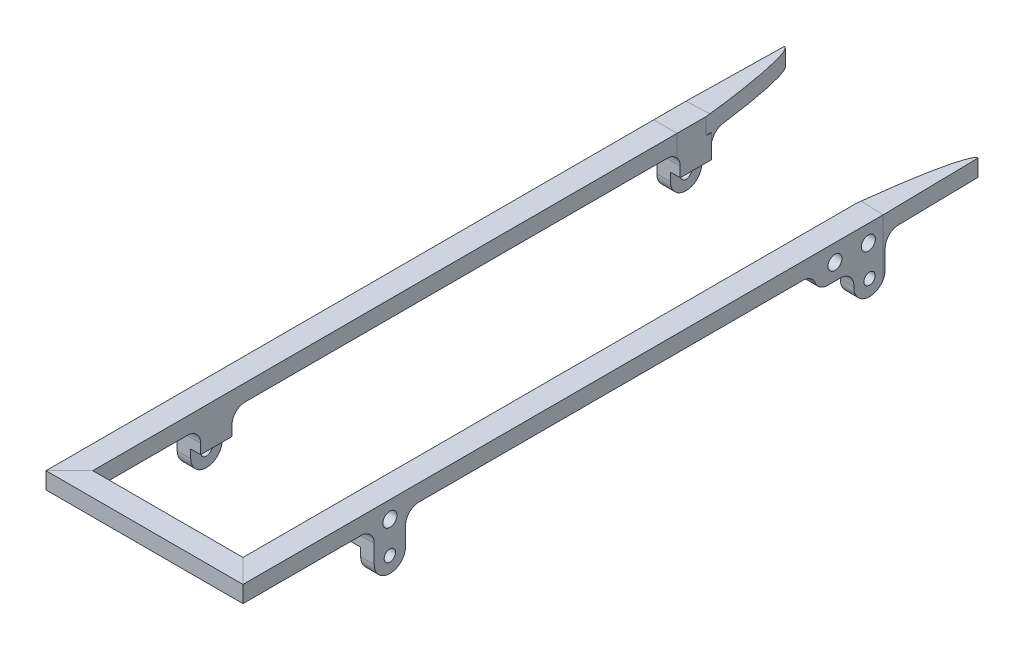
from build123d import *

# Parameters (mm, degrees)
SWEEP_PROFILE_W                = 8.89
SWEEP_PROFILE_H                = 6.35
MOUNTS_R                       = 5.969
MOUNTS_R_2                     = 2.159
BOSS_EXTRUDE1_DEPTH            = 8.89
BOSS_EXTRUDE2_START            = -8.89
SKETCH9_R                      = 5.969
SKETCH9_R_2                    = 2.159
BOSS_EXTRUDE2_DEPTH            = 8.89
CUT_EXTRUDE2_DEPTH             = 168.491937308
CUT_EXTRUDE2_DEPTH_BACK        = 168.491937308
SKETCH10_W                     = 64.643
SKETCH10_H                     = 9.144
FILLET1_R                      = 5.08
CUT_EXTRUDE3_REACH             = 182.277
SKETCH12_R                     = 2.667
SKETCH13_W                     = 14.301680358
SKETCH13_H                     = 6.35
BOSS_EXTRUDE3_DEPTH            = 8.89
SKETCH14_R                     = 2.667
CUT_EXTRUDE4_DEPTH             = 181.277200423
CUT_EXTRUDE4_DIRECTION_2_REACH = 182.277
FILLET6_R                      = 5.08
FILLET7_R                      = 5.08
FILLET8_R                      = 5.08
FILLET9_START                  = -15.24
FILLET9_DEPTH                  = 15.24
FILLET9_START_2                = -6.35
FILLET9_2_DEPTH                = 6.35
CUT_EXTRUDE5_DEPTH             = 168.075283763


with BuildPart() as part:
    # Sweep1: sweep along a path in Sweep_Path
    with BuildLine(Plane(origin=(0, 0, 0), x_dir=(1, 0, 0), z_dir=(0, 1, 0))) as sweep1_path:
        Line((31.75, 160.655), (28.575, 123.825))
        Line((28.575, 123.825), (28.575, 111.125))
        Line((28.575, 111.125), (28.575, -111.125))
        Line((28.575, -111.125), (-28.575, -111.125))
        Line((-28.575, -111.125), (-28.575, 111.125))
        Line((-28.575, 111.125), (-28.575, 123.825))
        Line((-28.575, 123.825), (-31.75, 160.655))
    # Sweep_Profile → Sweep1 (sweep)
    with BuildSketch(Plane.XY):
        with Locations((33.02, -3.175)):
            Rectangle(SWEEP_PROFILE_W, SWEEP_PROFILE_H)
    sweep(path=sweep1_path.line, transition=Transition.RIGHT)

    # Mounts → Boss-Extrude1 (add)
    # profile 1 of 4: a face of its own
    with BuildSketch(Plane(origin=(-28.575, 0, 0), x_dir=(0, 0, -1), z_dir=(1, 0, 0))):
        with BuildLine():
            Line((-70.104, -6.35), (-70.104, -18.415))
            ThreePointArc((-70.104, -18.415), (-64.135, -12.446), (-58.166, -18.415))
            Line((-58.166, -18.415), (-58.166, -6.35))
            Line((-58.166, -6.35), (-70.104, -6.35))
        make_face()
    # profile 2 of 4: a face of its own
    with BuildSketch(Plane(origin=(-28.575, 0, 0), x_dir=(0, 0, -1), z_dir=(1, 0, 0))):
        with Locations((-64.135, -18.415)):
            Circle(MOUNTS_R)
        with Locations((-64.135, -18.415)):
            Circle(MOUNTS_R_2, mode=Mode.SUBTRACT)
    # profile 3 of 4: a face of its own
    with BuildSketch(Plane(origin=(-28.575, 0, 0), x_dir=(0, 0, -1), z_dir=(1, 0, 0))):
        with BuildLine():
            Line((112.3442, -6.35), (112.3442, -18.415))
            ThreePointArc((112.3442, -18.415), (118.3132, -12.446), (124.2822, -18.415))
            Line((124.2822, -18.415), (124.2822, -6.35))
            Line((124.2822, -6.35), (112.3442, -6.35))
        make_face()
    # profile 4 of 4: a face of its own
    with BuildSketch(Plane(origin=(-28.575, 0, 0), x_dir=(0, 0, -1), z_dir=(1, 0, 0))):
        with Locations((118.3132, -18.415)):
            Circle(MOUNTS_R)
        with Locations((118.3132, -18.415)):
            Circle(MOUNTS_R_2, mode=Mode.SUBTRACT)
    extrude(amount=-BOSS_EXTRUDE1_DEPTH)

    # Sketch9 → Boss-Extrude2 (add)
    # profile 1 of 4: a face of its own
    with BuildSketch(Plane.ZY.offset(-28.575).offset(BOSS_EXTRUDE2_START)):
        with Locations((64.135, -18.415)):
            Circle(SKETCH9_R)
        with Locations(Location((64.135, -18.415, 0), (0, 0, 180))):
            Circle(SKETCH9_R_2, mode=Mode.SUBTRACT)
    # profile 2 of 4: a face of its own
    with BuildSketch(Plane.ZY.offset(-28.575).offset(BOSS_EXTRUDE2_START)):
        with BuildLine():
            Line((70.104, -18.415), (70.104, -6.35))
            Line((70.104, -6.35), (58.166, -6.35))
            Line((58.166, -6.35), (58.166, -18.415))
            ThreePointArc((58.166, -18.415), (64.135, -12.446), (70.104, -18.415))
        make_face()
    # profile 3 of 4: a face of its own
    with BuildSketch(Plane.ZY.offset(-28.575).offset(BOSS_EXTRUDE2_START)):
        with Locations((-118.3132, -18.415)):
            Circle(SKETCH9_R)
        with Locations(Location((-118.3132, -18.415, 0), (0, 0, 180))):
            Circle(SKETCH9_R_2, mode=Mode.SUBTRACT)
    # profile 4 of 4: a face of its own
    with BuildSketch(Plane.ZY.offset(-28.575).offset(BOSS_EXTRUDE2_START)):
        with BuildLine():
            Line((-112.3442, -18.415), (-112.3442, -6.35))
            Line((-112.3442, -6.35), (-124.2822, -6.35))
            Line((-124.2822, -6.35), (-124.2822, -18.415))
            ThreePointArc((-124.2822, -18.415), (-118.3132, -12.446), (-112.3442, -18.415))
        make_face()
    extrude(amount=BOSS_EXTRUDE2_DEPTH)

    # Sketch10 → Cut-Extrude2 (cut, two sides: drawn at the far end of the back side and taken through both)
    with BuildSketch(Plane.XY.offset(-CUT_EXTRUDE2_DEPTH_BACK)):
        with Locations((0, -19.812)):
            Rectangle(SKETCH10_W, SKETCH10_H)
    extrude(amount=CUT_EXTRUDE2_DEPTH + CUT_EXTRUDE2_DEPTH_BACK, mode=Mode.SUBTRACT)

    # Fillet1
    fillet1_edges = [part.edges().sort_by_distance(p)[0] for p in [
        (33.02, -6.35, 58.166),
        (33.02, -6.35, 70.104),
        (-33.02, -6.35, -112.3442),
        (-33.039706897, -6.35, -124.2822),
        (-33.02, -6.35, 58.166),
        (-33.02, -6.35, 70.104),
    ]]
    fillet(fillet1_edges, radius=FILLET1_R)

    # Sketch12 → Cut-Extrude3 (cut, up to next)
    with BuildSketch(Plane(origin=(37.465, 0, 0), x_dir=(0, 0, -1), z_dir=(1, 0, 0)), mode=Mode.PRIVATE) as cut_extrude3_sk1:
        with Locations((-64.135, -6.477)):
            Circle(SKETCH12_R)
    cut_extrude3_tool1 = extrude(cut_extrude3_sk1.sketch, amount=-CUT_EXTRUDE3_REACH, mode=Mode.PRIVATE) & part.part
    add(cut_extrude3_tool1.solids().sort_by_distance((37.465, -6.477, 64.135))[0], mode=Mode.SUBTRACT)

    # Sketch13 → Boss-Extrude3 (add)
    with BuildSketch(Plane(origin=(37.465, 0, 0), x_dir=(0, 0, -1), z_dir=(1, 0, 0))):
        with Locations((105.193359821, -9.525)):
            Rectangle(SKETCH13_W, SKETCH13_H)
    extrude(amount=-BOSS_EXTRUDE3_DEPTH)

    # Sketch14 → Cut-Extrude4 (cut)
    with BuildSketch(Plane(origin=(37.465, 0, 0), x_dir=(0, 0, -1), z_dir=(1, 0, 0))):
        with Locations(Location((105.154519642, -6.477, 0), (0, 0, 180))):
            Circle(SKETCH14_R)
        with Locations(Location((117.854519642, -6.477, 0), (0, 0, 180))):
            Circle(SKETCH14_R)
    extrude(amount=CUT_EXTRUDE4_DEPTH, mode=Mode.SUBTRACT)

    # Sketch14 → Cut-Extrude4 direction 2 (cut, up to next)
    with BuildSketch(Plane(origin=(37.465, 0, 0), x_dir=(0, 0, -1), z_dir=(1, 0, 0)), mode=Mode.PRIVATE) as cut_extrude4_direction_2_sk1:
        with Locations(Location((105.154519642, -6.477, 0), (0, 0, 180))):
            Circle(SKETCH14_R)
    cut_extrude4_direction_2_tool1 = extrude(cut_extrude4_direction_2_sk1.sketch, amount=-CUT_EXTRUDE4_DIRECTION_2_REACH, mode=Mode.PRIVATE) & part.part
    # Sketch14 → Cut-Extrude4 direction 2 (cut, up to next)
    with BuildSketch(Plane(origin=(37.465, 0, 0), x_dir=(0, 0, -1), z_dir=(1, 0, 0)), mode=Mode.PRIVATE) as cut_extrude4_direction_2_sk2:
        with Locations(Location((117.854519642, -6.477, 0), (0, 0, 180))):
            Circle(SKETCH14_R)
    cut_extrude4_direction_2_tool2 = extrude(cut_extrude4_direction_2_sk2.sketch, amount=-CUT_EXTRUDE4_DIRECTION_2_REACH, mode=Mode.PRIVATE) & part.part
    add(cut_extrude4_direction_2_tool1.solids().sort_by_distance((37.465, -6.477, -105.15452))[0], mode=Mode.SUBTRACT)
    add(cut_extrude4_direction_2_tool2.solids().sort_by_distance((37.465, -6.477, -117.85452))[0], mode=Mode.SUBTRACT)

    # Fillet6
    fillet6_edges = [part.edges().sort_by_distance(p)[0] for p in [
        (33.02, -12.7, -112.3442),
        (33.02, -6.35, -98.042519642),
    ]]
    fillet(fillet6_edges, radius=FILLET6_R)

    # Fillet7
    fillet7_edges = [part.edges().sort_by_distance(p)[0] for p in [
        (33.02, -12.7, -98.042519642),
    ]]
    fillet(fillet7_edges, radius=FILLET7_R)

    # Fillet8
    fillet8_edges = [part.edges().sort_by_distance(p)[0] for p in [
        (33.039706897, -6.35, -124.2822),
    ]]
    fillet(fillet8_edges, radius=FILLET8_R)

    # Fillet9: read off the stored shape, not the designer's step
    # Fillet9 outline → Fillet9 (cut)
    with BuildSketch(Plane(origin=(0, 0, 0), x_dir=(1, 0, 0), z_dir=(0, 1, 0)).offset(FILLET9_START)):
        with BuildLine():
            add(Edge.make_bspline(
                [(-28.820894228, 124.2822), (-33.022279501, 160.545320733), (-36.811228226, 160.218687222)],
                knots=[0.191878197, 0.191878197, 0.191878197, 1, 1, 1], degree=2, weights=[0.909167396, 0.763306604, 1]))
            Line((-28.820894228, 124.2822), (-28.614413793, 124.2822))
            Line((-28.614413793, 124.2822), (-31.75, 160.655))
            Line((-31.75, 160.655), (-36.811228226, 160.218687222))
        make_face()
        with BuildLine():
            Line((28.614413793, 124.2822), (28.820894228, 124.2822))
            add(Edge.make_bspline(
                [(28.820894228, 124.2822), (33.022279501, 160.545320733), (36.811228226, 160.218687222)],
                knots=[0.191878197, 0.191878197, 0.191878197, 1, 1, 1], degree=2, weights=[0.909167396, 0.763306604, 1]))
            Line((36.811228226, 160.218687222), (31.75, 160.655))
            Line((31.75, 160.655), (28.614413793, 124.2822))
        make_face()
    extrude(amount=FILLET9_DEPTH, mode=Mode.SUBTRACT)

    # Fillet9 2 outline → Fillet9 2 (cut)
    with BuildSketch(Plane(origin=(0, 0, 0), x_dir=(1, 0, 0), z_dir=(0, 1, 0)).offset(FILLET9_START_2)):
        with BuildLine():
            add(Edge.make_bspline(
                [(-28.575, 122.114374169), (-28.6960926, 123.205008499), (-28.820894228, 124.2822)],
                knots=[0.163122651, 0.163122651, 0.163122651, 0.191878197, 0.191878197, 0.191878197], degree=2, weights=[0.920032154, 0.914357587, 0.909167396]))
            Line((-28.575, 122.114374169), (-28.575, 123.825))
            Line((-28.575, 123.825), (-28.614413793, 124.2822))
            Line((-28.614413793, 124.2822), (-28.820894228, 124.2822))
        make_face()
        with BuildLine():
            Line((28.575, 123.825), (28.575, 122.114374169))
            add(Edge.make_bspline(
                [(28.575, 122.114374169), (28.6960926, 123.205008499), (28.820894228, 124.2822)],
                knots=[0.163122651, 0.163122651, 0.163122651, 0.191878197, 0.191878197, 0.191878197], degree=2, weights=[0.920032154, 0.914357587, 0.909167396]))
            Line((28.820894228, 124.2822), (28.614413793, 124.2822))
            Line((28.614413793, 124.2822), (28.575, 123.825))
        make_face()
    extrude(amount=FILLET9_2_DEPTH, mode=Mode.SUBTRACT)

    # Sketch15 → Cut-Extrude5 (cut, through all)
    with BuildSketch(Plane(origin=(0, 0, 0), x_dir=(1, 0, 0), z_dir=(0, 1, 0))):
        Polygon((36.811228226, 160.218687222), (37.465, 123.442519642), (40.607149396, 159.891452638), align=None)
        Polygon((-37.465, 123.442519642), (-36.811228226, 160.218687222), (-40.607149396, 159.891452638), align=None)
    extrude(amount=-CUT_EXTRUDE5_DEPTH, mode=Mode.SUBTRACT)


solid = part.part
